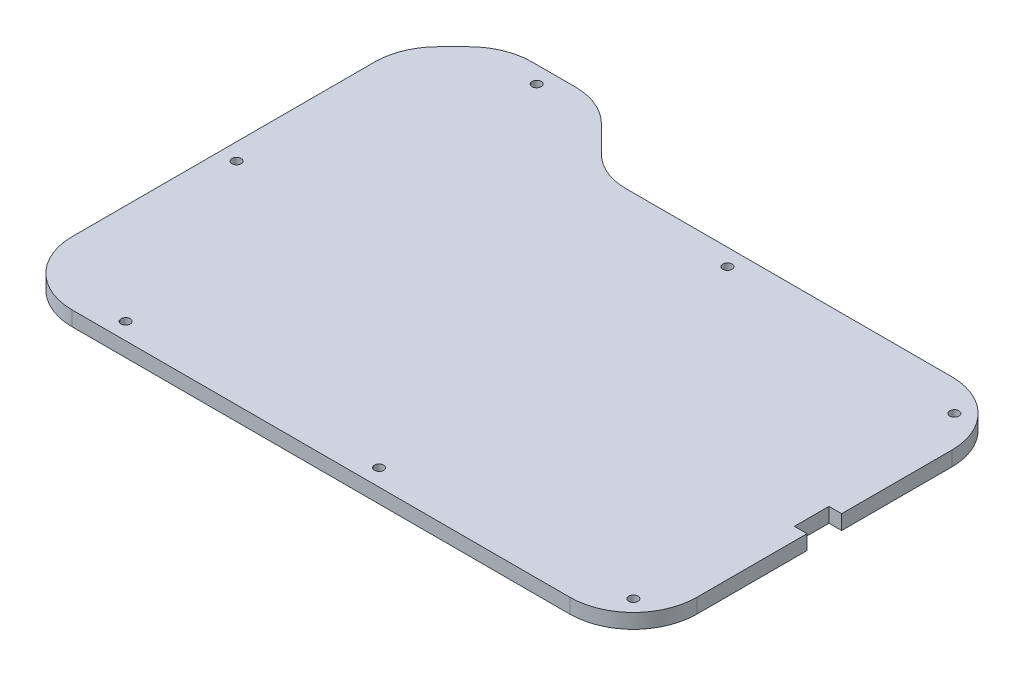
from build123d import *

# Parameters (mm, degrees)
SKETCH1_R           = 1
BOSS_EXTRUDE1_DEPTH = 3.175


with BuildPart() as part:
    # Sketch1 → Boss-Extrude1 (new body)
    with BuildSketch(Plane(origin=(0, 0, 0), x_dir=(1, 0, 0), z_dir=(0, 1, 0))):
        with BuildLine():
            Line((-37.321066228, -95.119565731), (-37.321066228, -71.219565731))
            Line((-37.321066228, -71.219565731), (-40.071066228, -71.219565731))
            Line((-40.071066228, -71.219565731), (-40.071066228, -63.719565731))
            Line((-40.071066228, -63.719565731), (-37.321066228, -63.719565731))
            Line((-37.321066228, -63.719565731), (-37.321066228, -39.81956573))
            ThreePointArc((-37.321066228, -39.81956573), (-41.348347987, -30.096847489), (-51.071066228, -26.06956573))
            Line((-51.071066228, -26.06956573), (-121.753952268, -26.06956573))
            ThreePointArc((-121.753952268, -26.06956573), (-126.652300203, -25.095223746), (-130.804919068, -22.320532529))
            Line((-130.804919068, -22.320532529), (-136.628604108, -16.496847489))
            ThreePointArc((-136.628604108, -16.496847489), (-141.089425154, -13.516222158), (-146.351322349, -12.46956573))
            Line((-146.351322349, -12.46956573), (-155.714324386, -12.46956573))
            ThreePointArc((-155.714324386, -12.46956573), (-160.976221581, -13.516222158), (-165.437042628, -16.496847489))
            Line((-165.437042628, -16.496847489), (-168.717298749, -19.77710361))
            ThreePointArc((-168.717298749, -19.77710361), (-171.697924079, -24.237924656), (-172.744580507, -29.499821851))
            Line((-172.744580507, -29.499821851), (-172.744580507, -95.119565731))
            ThreePointArc((-172.744580507, -95.119565731), (-168.717298749, -104.842283972), (-158.994580507, -108.869565731))
            Line((-158.994580507, -108.869565731), (-51.071066228, -108.869565731))
            ThreePointArc((-51.071066228, -108.869565731), (-41.348347987, -104.842283972), (-37.321066228, -95.119565731))
        make_face()
        with Locations((-169.094580507, -63.109693791)):
            Circle(SKETCH1_R, mode=Mode.SUBTRACT)
        with Locations((-151.032823368, -16.11956573)):
            Circle(SKETCH1_R, mode=Mode.SUBTRACT)
        with Locations((-96.075392509, -29.71956573)):
            Circle(SKETCH1_R, mode=Mode.SUBTRACT)
        with Locations((-43.929287738, -32.67778724)):
            Circle(SKETCH1_R, mode=Mode.SUBTRACT)
        with Locations((-43.929287738, -102.26134422)):
            Circle(SKETCH1_R, mode=Mode.SUBTRACT)
        with Locations((-96.075392509, -105.21956573)):
            Circle(SKETCH1_R, mode=Mode.SUBTRACT)
        with Locations((-151.032823368, -105.21956573)):
            Circle(SKETCH1_R, mode=Mode.SUBTRACT)
    extrude(amount=BOSS_EXTRUDE1_DEPTH)


solid = part.part
